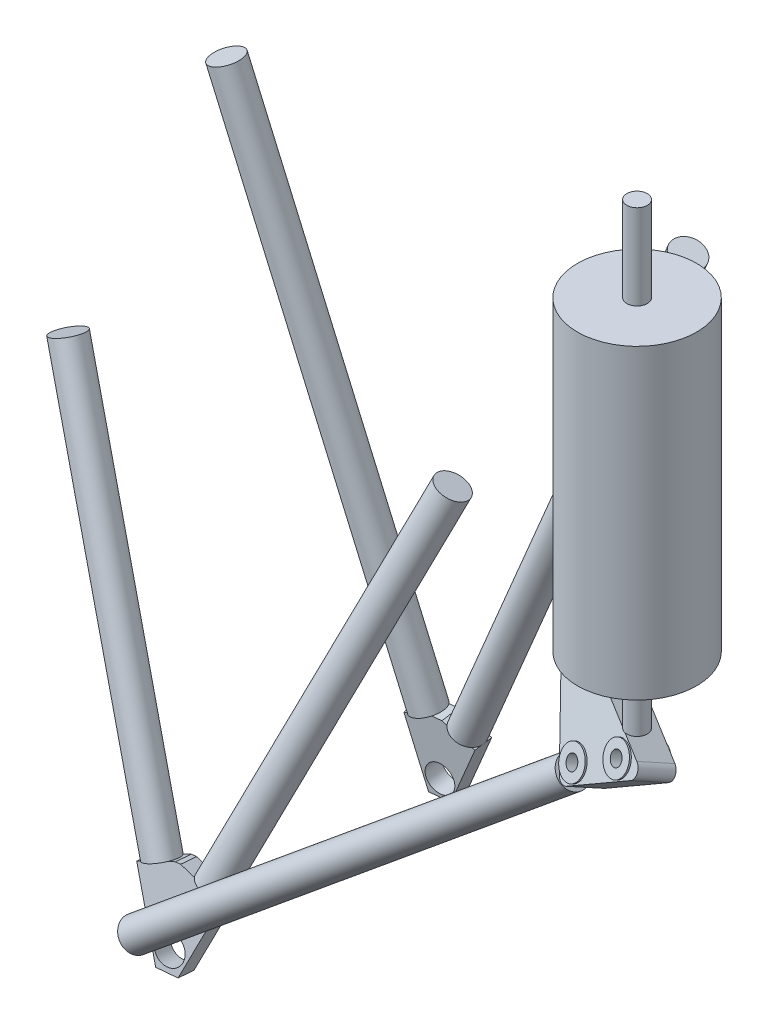
from build123d import *

# Parameters (mm, degrees)
BOSS_EXTRUDE3_DEPTH       = 5.5
BOSS_EXTRUDE3_DEPTH_BACK  = 5.5
CUT_EXTRUDE1_START        = 334.582659855
CUT_EXTRUDE1_OUTLINE_R    = 8
CUT_EXTRUDE1_DEPTH        = 11
BOSS_EXTRUDE4_START       = -126.025031836
BOSS_EXTRUDE4_OUTLINE_R   = 9
BOSS_EXTRUDE4_DEPTH       = 241
BOSS_EXTRUDE5_START       = 743.218117344
BOSS_EXTRUDE5_OUTLINE_R   = 9
BOSS_EXTRUDE5_DEPTH       = 228
BOSS_EXTRUDE6_DEPTH       = 5.5
CUT_EXTRUDE2_DEPTH        = 5.5
CUT_EXTRUDE2_DEPTH_BACK   = 5.5
SKETCH7_R                 = 8
SKETCH8_R                 = 9
BOSS_EXTRUDE7_DEPTH       = 332.697857842
SKETCH9_R                 = 9
BOSS_EXTRUDE8_DEPTH       = 309.888930441
BOSS_EXTRUDE10_DEPTH      = 10
SKETCH13_R                = 35
BOSS_EXTRUDE12_DEPTH      = 180
FILLET1_R                 = 5
FILLET2_R                 = 5
FILLET3_R                 = 5
BOSS_EXTRUDE14_DEPTH      = 1
BOSS_EXTRUDE14_DEPTH_BACK = 21
SKETCH15_R                = 9
SKETCH15_R_2              = 4
SKETCH16_R                = 4
CUT_EXTRUDE5_DEPTH        = 21
BOSS_EXTRUDE17_DEPTH      = 1
BOSS_EXTRUDE17_DEPTH_BACK = 21
SKETCH18_R                = 9
SKETCH18_R_2              = 4
CUT_EXTRUDE6_DEPTH        = 1
CUT_EXTRUDE6_DEPTH_BACK   = 21
SKETCH20_R                = 4
SKETCH21_R                = 9
SKETCH21_R_2              = 4
BOSS_EXTRUDE19_DEPTH      = 11
SKETCH22_R                = 4
CUT_EXTRUDE7_DEPTH        = 22
SKETCH23_R                = 6
BOSS_EXTRUDE21_DEPTH      = 50
SKETCH10_R                = 9
BOSS_EXTRUDE22_DEPTH      = 333
SKETCH24_R                = 6
BOSS_EXTRUDE23_DEPTH      = 39


# Read off the part's stored shape, not the designer's step: Cut-Extrude1, Boss-Extrude4, Boss-Extrude5
with BuildPart() as part:
    # 3DSketch4 → Boss-Extrude3 (new, two sides: drawn at the far end of the back side and taken through both)
    with BuildSketch(Plane(origin=(1200.599227071, -534.096277105, 304.062957014), x_dir=(-0.382515316114057, -0.8956658518967009, 0.22685835819806208), z_dir=(-0.12305693112364045, -0.19395769250788458, -0.973261221471116)).offset(-BOSS_EXTRUDE3_DEPTH_BACK)):
        Polygon((0, 0), (-0.279752242, -9.592956607), (44.138212359, -10.888284593), (48.686486711, 0), (16.081118939, 32.58922022), (9.611577246, 26.11647295), (1.515769737, 18.016654069), (0.451077286, 15.467846872), align=None)
    extrude(amount=BOSS_EXTRUDE3_DEPTH + BOSS_EXTRUDE3_DEPTH_BACK)

    # Cut-Extrude1 outline → Cut-Extrude1 (cut)
    with BuildSketch(Plane(origin=(0, 0, 0), x_dir=(0.992399612909251, -0.02405063252480931, -0.12068378255890523), z_dir=(0.12305693112364104, 0.19395769250788705, 0.9732612214711154)).offset(CUT_EXTRUDE1_START)):
        with Locations((1154.424544959, -617.607547164)):
            Circle(CUT_EXTRUDE1_OUTLINE_R)
    extrude(amount=CUT_EXTRUDE1_DEPTH, mode=Mode.SUBTRACT)

    # Boss-Extrude4 outline → Boss-Extrude4 (add)
    with BuildSketch(Plane(origin=(0, 0, 0), x_dir=(0.9346155161819424, -0.3451322804950485, 0.08589264154890401), z_dir=(0.3556597206768871, 0.9069511269705414, -0.22571179937013408)).offset(BOSS_EXTRUDE4_START)):
        with Locations((1332.549303033, -166.077287509)):
            Circle(BOSS_EXTRUDE4_OUTLINE_R)
    extrude(amount=BOSS_EXTRUDE4_DEPTH)

    # Boss-Extrude5 outline → Boss-Extrude5 (add)
    with BuildSketch(Plane(origin=(0, 0, 0), x_dir=(0.9262931406329792, 0.3727813126307993, -0.05491002248724934), z_dir=(0.376803685778539, -0.916404976593078, 0.134984818624719)).offset(BOSS_EXTRUDE5_START)):
        with Locations((871.267130908, 226.342092845)):
            Circle(BOSS_EXTRUDE5_OUTLINE_R)
    extrude(amount=BOSS_EXTRUDE5_DEPTH)


with BuildPart() as body_2:
    # Sketch6 → Boss-Extrude6 (new, symmetric)
    with BuildSketch(Plane(origin=(26.952024064, -11.036414307, 273.454344487), x_dir=(-0.9951857213114613, -0.003952273848494241, 0.09792731809466178), z_dir=(-0.09800704106229594, 0.040132284967506364, -0.9943761962182625))):
        Polygon((-1146.835530247, -536.916979065), (-1132.145169023, -541.796584985), (-1144.096696824, -577.777412829), (-1156.091608569, -577.777412829), (-1170.248325105, -544.323864719), (-1152.745212363, -536.916979065), align=None)
    extrude(amount=BOSS_EXTRUDE6_DEPTH, both=True)

    # Sketch7 → Cut-Extrude2 (cut, two sides: drawn at the far end of the back side and taken through both)
    with BuildSketch(Plane(origin=(26.952024064, -11.036414307, 273.454344487), x_dir=(-0.9951857213114613, -0.003952273848494241, 0.09792731809466178), z_dir=(-0.09800704106229594, 0.040132284967506364, -0.9943761962182625)).offset(-CUT_EXTRUDE2_DEPTH_BACK)):
        with Locations(Location((-1150.587223486, -567.973034168, 0), (0, 0, 0.226631782))):
            Circle(SKETCH7_R)
    extrude(amount=CUT_EXTRUDE2_DEPTH + CUT_EXTRUDE2_DEPTH_BACK, mode=Mode.SUBTRACT)

    # Sketch8 → Boss-Extrude7 (add)
    with BuildSketch(Plane(origin=(111.495119962, 264.97463301, -0.294927936), x_dir=(0.9217264367108834, -0.3878404175924364, 0.00043168273353130435), z_dir=(0.3878406578329016, 0.9217258657651006, -0.001025919742377429))):
        with Locations(Location((1302.943302255, -137.237128795, 0), (0, 0, 180.024733613))):
            Circle(SKETCH8_R)
    extrude(amount=-BOSS_EXTRUDE7_DEPTH)

    # Sketch9 → Boss-Extrude8 (add)
    with BuildSketch(Plane(origin=(176.044973847, -531.426026978, -38.799186748), x_dir=(0.949518494071323, 0.3128782858475271, 0.02284310971912741), z_dir=(-0.31371106039877994, 0.9469979108416423, 0.0691399120988602))):
        with Locations(Location((936.393057855, -179.306342386, 0), (0, 0, 181.312067991))):
            Circle(SKETCH9_R)
    extrude(amount=-BOSS_EXTRUDE8_DEPTH)


with BuildPart() as body_3:
    # Sketch11 → Boss-Extrude10 (new, symmetric)
    with BuildSketch(Plane(origin=(34.841554728, -60.328152011, -138.721650148), x_dir=(0.9744861563673539, 0.08951108154828352, 0.20582637665867218), z_dir=(-0.2244476131492181, 0.3886310421678697, 0.8936381717536099))):
        Polygon((1451.890744425, -449.361574785), (1503.219305304, -422.870577787), (1414.287348828, -372.188484488), align=None)
    extrude(amount=BOSS_EXTRUDE10_DEPTH, both=True)

    # Fillet1
    fillet1_edges = [body_3.edges().sort_by_distance(p)[0] for p in [
        (1413.044997286, -275.043727724, 300.807035499),
    ]]
    fillet(fillet1_edges, radius=FILLET1_R)

    # Fillet2
    fillet2_edges = [body_3.edges().sort_by_distance(p)[0] for p in [
        (1499.70795773, -313.560599032, 339.323906808),
    ]]
    fillet(fillet2_edges, radius=FILLET2_R)

    # Fillet3
    fillet3_edges = [body_3.edges().sort_by_distance(p)[0] for p in [
        (1449.688985727, -342.448252514, 339.323906808),
    ]]
    fillet(fillet3_edges, radius=FILLET3_R)

    # Sketch15 → Boss-Extrude14 (add, two sides: drawn at the far end of the back side and taken through both)
    with BuildSketch(Plane(origin=(37.086030859, -64.214462433, -147.658031866), x_dir=(-0.9744861563673538, -0.08951108154828336, -0.2058263766586726), z_dir=(0.22444761314921843, -0.3886310421678689, -0.8936381717536103)).offset(-BOSS_EXTRUDE14_DEPTH_BACK)):
        with Locations(Location((-1456.342848997, -436.221687735, 0), (0, 0, 90))):
            Circle(SKETCH15_R)
        with Locations(Location((-1456.342848997, -436.221687735, 0), (0, 0, 90))):
            Circle(SKETCH15_R_2, mode=Mode.SUBTRACT)
    extrude(amount=BOSS_EXTRUDE14_DEPTH + BOSS_EXTRUDE14_DEPTH_BACK)

    # Sketch16 → Cut-Extrude5 (cut)
    with BuildSketch(Plane(origin=(37.086030859, -64.214462433, -147.658031866), x_dir=(-0.9744861563673537, -0.0895110815482837, -0.2058263766586731), z_dir=(0.224447613149219, -0.38863104216786926, -0.8936381717536099))):
        with Locations(Location((-1456.342848997, -436.221687735, 0), (0, 0, 90))):
            Circle(SKETCH16_R)
    extrude(amount=-CUT_EXTRUDE5_DEPTH, mode=Mode.SUBTRACT)

    # Sketch20 → Cut-Extrude6 (cut, two sides: drawn at the far end of the back side and taken through both)
    with BuildSketch(Plane(origin=(37.086030859, -64.214462433, -147.658031866), x_dir=(-0.9744861563673538, -0.08951108154828336, -0.2058263766586726), z_dir=(0.22444761314921843, -0.3886310421678689, -0.8936381717536103)).offset(-CUT_EXTRUDE6_DEPTH_BACK)):
        with Locations(Location((-1436.817173978, -396.149331037, 0), (0, 0, 90))):
            Circle(SKETCH20_R)
    extrude(amount=CUT_EXTRUDE6_DEPTH + CUT_EXTRUDE6_DEPTH_BACK, mode=Mode.SUBTRACT)

    # Sketch21 → Boss-Extrude19 (add, symmetric)
    with BuildSketch(Plane(origin=(34.841554728, -60.328152011, -138.721650148), x_dir=(0.9744861563673539, 0.08951108154828352, 0.20582637665867218), z_dir=(-0.2244476131492181, 0.3886310421678697, 0.8936381717536099))):
        with Locations(Location((1482.995356917, -422.466158743, 0), (0, 0, 90))):
            Circle(SKETCH21_R)
        with Locations(Location((1482.995356917, -422.466158743, 0), (0, 0, 90))):
            Circle(SKETCH21_R_2, mode=Mode.SUBTRACT)
    extrude(amount=BOSS_EXTRUDE19_DEPTH, both=True)

    # Sketch22 → Cut-Extrude7 (cut)
    with BuildSketch(Plane(origin=(32.597078596, -56.441841589, -129.785268431), x_dir=(0.9744861563673537, 0.0895110815482837, 0.2058263766586731), z_dir=(-0.224447613149219, 0.38863104216786926, 0.8936381717536099))):
        with Locations(Location((1482.995356917, -422.466158743, 0), (0, 0, 270))):
            Circle(SKETCH22_R)
    extrude(amount=-CUT_EXTRUDE7_DEPTH, mode=Mode.SUBTRACT)


with BuildPart() as body_4:
    # Sketch13 → Boss-Extrude12 (new body)
    with BuildSketch(Plane(origin=(1480, -80, 335), x_dir=(-1, 0, 0), z_dir=(0, -1, 0))):
        with Locations(Location((0, 0, 0), (0, 0, 270))):
            Circle(SKETCH13_R)
    extrude(amount=BOSS_EXTRUDE12_DEPTH)

    # Sketch24 → Boss-Extrude23 (add)
    with BuildSketch(Plane(origin=(0, -260, 0), x_dir=(-1, 0, 0), z_dir=(0, -1, 0))):
        with Locations(Location((-1480, -335, 0), (0, 0, 90))):
            Circle(SKETCH24_R)
    extrude(amount=BOSS_EXTRUDE23_DEPTH)


with BuildPart() as body_5:
    # Sketch18 → Boss-Extrude17 (new, two sides: drawn at the far end of the back side and taken through both)
    with BuildSketch(Plane(origin=(37.086030859, -64.214462433, -147.658031866), x_dir=(-0.9744861563673537, -0.0895110815482837, -0.2058263766586731), z_dir=(0.224447613149219, -0.38863104216786926, -0.8936381717536099)).offset(-BOSS_EXTRUDE17_DEPTH_BACK)):
        with Locations(Location((-1436.817173978, -396.149331037, 0), (0, 0, 90))):
            Circle(SKETCH18_R)
        with Locations(Location((-1436.817173978, -396.149331037, 0), (0, 0, 90))):
            Circle(SKETCH18_R_2, mode=Mode.SUBTRACT)
    extrude(amount=BOSS_EXTRUDE17_DEPTH + BOSS_EXTRUDE17_DEPTH_BACK)


with BuildPart() as body_6:
    # Sketch23 → Boss-Extrude21 (new body)
    with BuildSketch(Plane(origin=(1480, -30, 335), x_dir=(-1, 0, 0), z_dir=(0, -1, 0))):
        with Locations(Location((0, 0, 0), (0, 0, 90))):
            Circle(SKETCH23_R)
    extrude(amount=BOSS_EXTRUDE21_DEPTH)


with BuildPart() as body_7:
    # Sketch10 → Boss-Extrude22 (new body)
    with BuildSketch(Plane(origin=(1185.5, -551.15, 335), x_dir=(0, 0, 1), z_dir=(-0.7719165439130806, -0.6357238781367938, 0))):
        with Locations(Location((0, 0, 0), (0, 0, 270))):
            Circle(SKETCH10_R)
    extrude(amount=-BOSS_EXTRUDE22_DEPTH)


solid = Compound([part.part, body_2.part, body_3.part, body_4.part, body_5.part, body_6.part, body_7.part])
